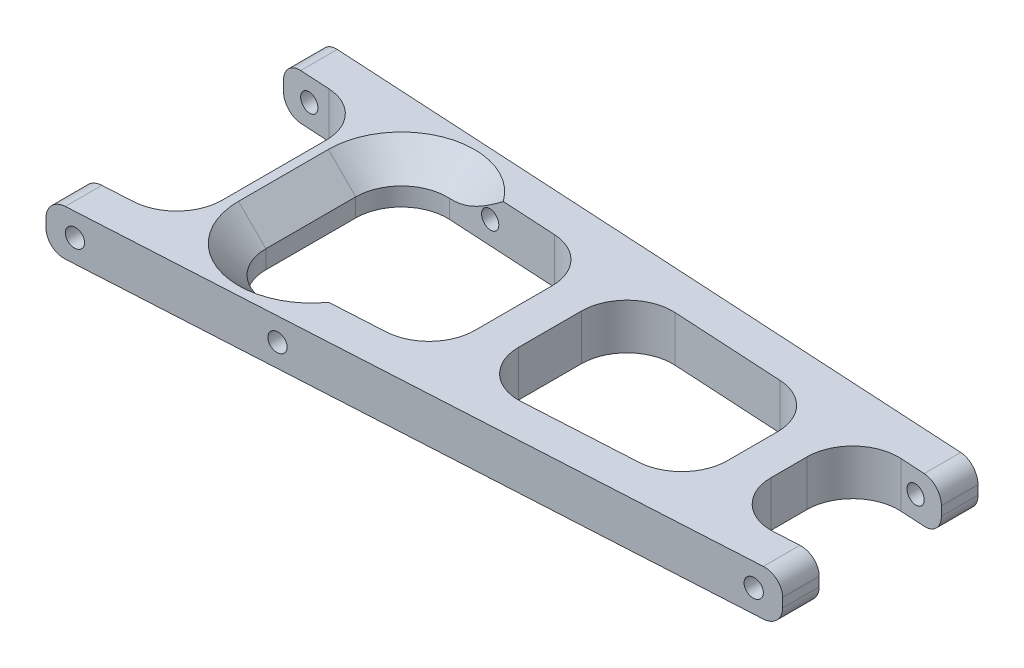
from build123d import *

# Parameters (mm, degrees)
ARM_DEPTH               = 6.35
CUT_EXTRUDE1_DEPTH      = 100.058228154
CUT_EXTRUDE1_DEPTH_BACK = 100.058228154
SKETCH2_R               = 1.27
CUT_EXTRUDE2_DEPTH      = 100.058228154
CUT_EXTRUDE2_DEPTH_BACK = 100.058228154
SKETCH3_R               = 1.27
FILLET2_R               = 6.35
FILLET3_R               = 2.54
CHAMFER1_SIZE           = 3.81


with BuildPart() as part:
    # Sketch1 → Arm (new body)
    with BuildSketch(Plane(origin=(0, 0, 0), x_dir=(1, 0, 0), z_dir=(0, 1, 0))):
        Polygon((0, -19.058070864), (97, -13.588070864), (97, -8.5), (84.3, -9.216175258), (84.3, 9.216175258), (97, 8.5), (97, 13.588070864), (0, 19.058070864), (0, 13.97), (12.7, 13.253824742), (12.7, -13.253824742), (0, -13.97), align=None)
        Polygon((79.22, -9.502645361), (51.04, -11.091764948), (51.04, 11.091764948), (79.22, 9.502645361), align=None, mode=Mode.SUBTRACT)
        Polygon((17.78, 12.967354639), (17.78, -12.967354639), (45.96, -11.378235052), (45.96, 11.378235052), align=None, mode=Mode.SUBTRACT)
    extrude(amount=ARM_DEPTH)

    # Sketch2 → Cut-Extrude1 (cut, two sides: drawn at the far end of the back side and taken through both)
    with BuildSketch(Plane.XY.offset(-CUT_EXTRUDE1_DEPTH_BACK)):
        with Locations(Location((30.48, 3.175, 0), (0, 0, 180))):
            Circle(SKETCH2_R)
    extrude(amount=CUT_EXTRUDE1_DEPTH + CUT_EXTRUDE1_DEPTH_BACK, mode=Mode.SUBTRACT)

    # Sketch3 → Cut-Extrude2 (cut, two sides: drawn at the far end of the back side and taken through both)
    with BuildSketch(Plane.XY.offset(-CUT_EXTRUDE2_DEPTH_BACK)):
        with Locations((93.19, 3.175)):
            Circle(SKETCH3_R)
        with Locations(Location((3.81, 3.175, 0), (0, 0, 180))):
            Circle(SKETCH3_R)
    extrude(amount=CUT_EXTRUDE2_DEPTH + CUT_EXTRUDE2_DEPTH_BACK, mode=Mode.SUBTRACT)

    # Fillet2
    fillet2_edges = [part.edges().sort_by_distance(p)[0] for p in [
        (12.7, 3.175, 13.253824742),
        (12.7, 3.175, -13.253824742),
        (84.3, 3.175, -9.216175258),
        (84.3, 3.175, 9.216175258),
        (45.96, 3.175, -11.378235052),
        (17.78, 3.175, -12.967354639),
        (17.78, 3.175, 12.967354639),
        (45.96, 3.175, 11.378235052),
        (79.22, 3.175, 9.502645361),
        (79.22, 3.175, -9.502645361),
        (51.04, 3.175, -11.091764948),
        (51.04, 3.175, 11.091764948),
    ]]
    fillet(fillet2_edges, radius=FILLET2_R)

    # Fillet3
    fillet3_edges = [part.edges().sort_by_distance(p)[0] for p in [
        (97, 6.35, 11.044035432),
        (0, 0, -16.514035432),
        (97, 0, -11.044035432),
        (97, 0, 11.044035432),
        (0, 0, 16.514035432),
        (97, 6.35, -11.044035432),
        (0, 6.35, -16.514035432),
        (0, 6.35, 16.514035432),
    ]]
    fillet(fillet3_edges, radius=FILLET3_R)

    # Chamfer1
    # the kernel refuses this chamfer: 3.81 mm, written as the material it takes off along each edge
    with BuildSketch(Plane(origin=(17.78, 6.35, -6.24917843), x_dir=(0.027495876610586382, -0.9996219169112968, 0), z_dir=(0, 0, 1))) as chamfer1_piece_1:
        Polygon((CHAMFER1_SIZE * 0.999621916911, -CHAMFER1_SIZE * 0.0274958766106), (-CHAMFER1_SIZE * 0.0274958766106, -CHAMFER1_SIZE * 0.999621916911), (0, 0), align=None)
    extrude(amount=12.49835686, mode=Mode.SUBTRACT)
    with BuildSketch(Plane(origin=(24.13, 6.35, 6.24917843), x_dir=(0.9995733988743083, 0, -0.02920651062456478), z_dir=(-0.02920651062456478, 0, -0.9995733988743083))) as chamfer1_piece_2:
        Polygon((6.35, CHAMFER1_SIZE), (6.35 + CHAMFER1_SIZE, 0), (6.35, 0), align=None)
    revolve(axis=Axis((24.13, 6.35, 6.24917843), (0, -1, 0)), revolution_arc=181.673647793, mode=Mode.SUBTRACT)
    with BuildSketch(Plane(origin=(24.13, 6.35, -6.24917843), x_dir=(0.9995733988743084, 0, 0.029206510624563663), z_dir=(-0.029206510624563663, 0, 0.9995733988743084))) as chamfer1_piece_3:
        Polygon((6.35, -CHAMFER1_SIZE), (6.35 + CHAMFER1_SIZE, 0), (6.35, 0), align=None)
    revolve(axis=Axis((24.13, 6.35, -6.24917843), (0, 1, 0)), revolution_arc=181.673647793, mode=Mode.SUBTRACT)


solid = part.part
